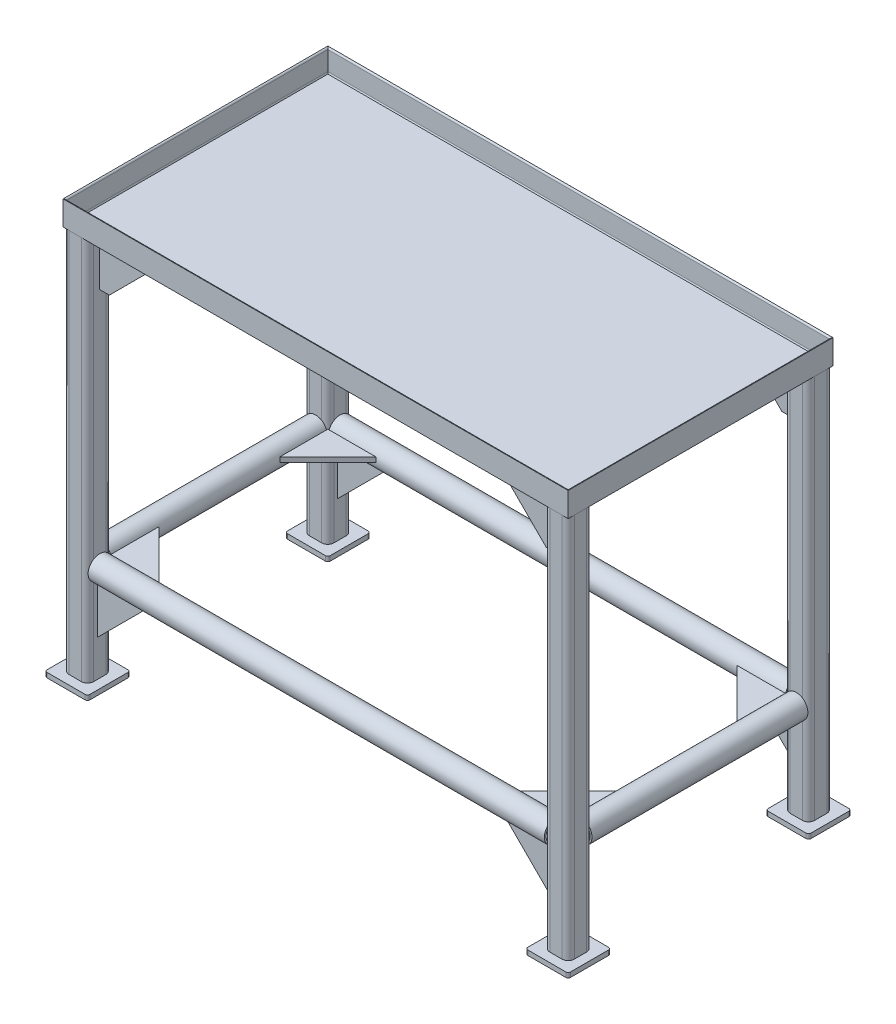
from build123d import *

# Parameters (mm, degrees)
ANGLE_IRON_2_X_2_X_0_125_1_DEPTH      = 598.242048969
ANGLE_IRON_2_X_2_X_0_125_1_DEPTH_BACK = 98.242048969
ANGLE_IRON_2_X_2_X_0_125_1_2_DEPTH    = 1196.484097937
ANGLE_IRON_2_X_2_X_0_125_1_3_DEPTH    = 696.484097937
ANGLE_IRON_2_X_2_X_0_125_1_4_DEPTH    = 1196.484097937
SQUARE_TUBE_2_X_2_X_0_25_1_DEPTH      = 800
SQUARE_TUBE_2_X_2_X_0_25_1_2_DEPTH    = 800
SQUARE_TUBE_2_X_2_X_0_25_1_3_DEPTH    = 800
SQUARE_TUBE_2_X_2_X_0_25_1_4_DEPTH    = 800
PIPE_1_5_SCH_40_1_DEPTH               = 1035.12497326
PIPE_1_5_SCH_40_1_DEPTH_BACK          = 35.12497326
SKETCH12_R                            = 24.13
SKETCH12_R_2                          = 20.447
SKETCH12_ON_SEGMENT_2_R               = 24.13
SKETCH12_ON_SEGMENT_2_R_2             = 20.447
PIPE_1_5_SCH_40_1_2_DEPTH             = 570.24994652
SKETCH12_ON_SEGMENT_3_R               = 24.13
SKETCH12_ON_SEGMENT_3_R_2             = 20.447
PIPE_1_5_SCH_40_1_3_DEPTH             = 1070.24994652
SKETCH12_ON_SEGMENT_4_R               = 24.13
SKETCH12_ON_SEGMENT_4_R_2             = 20.447
PIPE_1_5_SCH_40_1_4_DEPTH             = 570.24994652
SKETCH13_W                            = 1034.925
SKETCH13_H                            = 534.925
BOSS_EXTRUDE1_DEPTH                   = 5
GUSSET1_START                         = 240
GUSSET1_DEPTH                         = 10
GUSSET2_START                         = -600
GUSSET2_DEPTH                         = 10
GUSSET3_START                         = 245
GUSSET3_DEPTH                         = 10
END_START                             = -810
END_CAP1_DEPTH                        = 10


# Read off the part's stored shape, not the designer's step: Gusset1, Gusset2, Gusset3, End cap1
with BuildPart() as part:
    # Sketch1 → Angle iron 2 X 2 X 0.125(1) (new, two sides: drawn at the far end of the back side and taken through both)
    with BuildSketch(Plane(origin=(-525.4, 0, -250), x_dir=(1, 0, 0), z_dir=(0, 0, 1)).offset(-ANGLE_IRON_2_X_2_X_0_125_1_DEPTH_BACK)):
        with BuildLine():
            Line((0, 0), (0, 50.8))
            Line((0, 50.8), (0.00508, 50.8))
            ThreePointArc((0.00508, 50.8), (2.246551928, 49.871551928), (3.175, 47.63008))
            Line((3.175, 47.63008), (3.175, 7.9375))
            ThreePointArc((3.175, 7.9375), (4.569903955, 4.569903955), (7.9375, 3.175))
            Line((7.9375, 3.175), (47.63008, 3.175))
            ThreePointArc((47.63008, 3.175), (49.871551928, 2.246551928), (50.8, 0.00508))
            Line((50.8, 0.00508), (50.8, 0))
            Line((50.8, 0), (0, 0))
        make_face()
    extrude(amount=ANGLE_IRON_2_X_2_X_0_125_1_DEPTH + ANGLE_IRON_2_X_2_X_0_125_1_DEPTH_BACK)

    # Angle iron 2 X 2 X 0.125(1) mitre 1
    split(bisect_by=Plane(origin=(-500, 0, -250), x_dir=(0, -1, 0), z_dir=(-0.707106781, 0, 0.707106781)), keep=Keep.TOP)

    # Angle iron 2 X 2 X 0.125(1) mitre 2
    split(bisect_by=Plane(origin=(-500, 0, 250), x_dir=(0, -1, 0), z_dir=(-0.707106781, 0, -0.707106781)), keep=Keep.TOP)


with BuildPart() as body_2:
    # Sketch1 on segment 2 (carried to segment 2) → Angle iron 2 X 2 X 0.125_1 2 (new body)
    with BuildSketch(Plane(origin=(-598.242048969, 0, 275.4), x_dir=(0, 0, -1), z_dir=(1, 0, 0))):
        with BuildLine():
            Line((0, 0), (0, 50.8))
            Line((0, 50.8), (0.00508, 50.8))
            ThreePointArc((0.00508, 50.8), (2.246551928, 49.871551928), (3.175, 47.63008))
            Line((3.175, 47.63008), (3.175, 7.9375))
            ThreePointArc((3.175, 7.9375), (4.569903955, 4.569903955), (7.9375, 3.175))
            Line((7.9375, 3.175), (47.63008, 3.175))
            ThreePointArc((47.63008, 3.175), (49.871551928, 2.246551928), (50.8, 0.00508))
            Line((50.8, 0.00508), (50.8, 0))
            Line((50.8, 0), (0, 0))
        make_face()
    extrude(amount=ANGLE_IRON_2_X_2_X_0_125_1_2_DEPTH)

    # Angle iron 2 X 2 X 0.125_1 2 mitre 1
    split(bisect_by=Plane(origin=(-500, 0, 250), x_dir=(0, 1, 0), z_dir=(0.707106781, 0, 0.707106781)), keep=Keep.TOP)

    # Angle iron 2 X 2 X 0.125_1 2 mitre 2
    split(bisect_by=Plane(origin=(500, 0, 250), x_dir=(0, -1, 0), z_dir=(-0.707106781, 0, 0.707106781)), keep=Keep.TOP)


with BuildPart() as body_3:
    # Sketch1 on segment 3 (carried to segment 3) → Angle iron 2 X 2 X 0.125_1 3 (new body)
    with BuildSketch(Plane(origin=(525.4, 0, 348.242048969), x_dir=(-1, 0, 0), z_dir=(0, 0, -1))):
        with BuildLine():
            Line((0, 0), (0, 50.8))
            Line((0, 50.8), (0.00508, 50.8))
            ThreePointArc((0.00508, 50.8), (2.246551928, 49.871551928), (3.175, 47.63008))
            Line((3.175, 47.63008), (3.175, 7.9375))
            ThreePointArc((3.175, 7.9375), (4.569903955, 4.569903955), (7.9375, 3.175))
            Line((7.9375, 3.175), (47.63008, 3.175))
            ThreePointArc((47.63008, 3.175), (49.871551928, 2.246551928), (50.8, 0.00508))
            Line((50.8, 0.00508), (50.8, 0))
            Line((50.8, 0), (0, 0))
        make_face()
    extrude(amount=ANGLE_IRON_2_X_2_X_0_125_1_3_DEPTH)

    # Angle iron 2 X 2 X 0.125_1 3 mitre 1
    split(bisect_by=Plane(origin=(500, 0, -250), x_dir=(0, 1, 0), z_dir=(0.707106781, 0, 0.707106781)), keep=Keep.TOP)

    # Angle iron 2 X 2 X 0.125_1 3 mitre 2
    split(bisect_by=Plane(origin=(500, 0, 250), x_dir=(0, 1, 0), z_dir=(0.707106781, 0, -0.707106781)), keep=Keep.TOP)


with BuildPart() as body_4:
    # Sketch1 on segment 4 (carried to segment 4) → Angle iron 2 X 2 X 0.125_1 4 (new body)
    with BuildSketch(Plane(origin=(598.242048969, 0, -275.4), x_dir=(0, 0, 1), z_dir=(-1, 0, 0))):
        with BuildLine():
            Line((0, 0), (0, 50.8))
            Line((0, 50.8), (0.00508, 50.8))
            ThreePointArc((0.00508, 50.8), (2.246551928, 49.871551928), (3.175, 47.63008))
            Line((3.175, 47.63008), (3.175, 7.9375))
            ThreePointArc((3.175, 7.9375), (4.569903955, 4.569903955), (7.9375, 3.175))
            Line((7.9375, 3.175), (47.63008, 3.175))
            ThreePointArc((47.63008, 3.175), (49.871551928, 2.246551928), (50.8, 0.00508))
            Line((50.8, 0.00508), (50.8, 0))
            Line((50.8, 0), (0, 0))
        make_face()
    extrude(amount=ANGLE_IRON_2_X_2_X_0_125_1_4_DEPTH)

    # Angle iron 2 X 2 X 0.125_1 4 mitre 1
    split(bisect_by=Plane(origin=(-500, 0, -250), x_dir=(0, 1, 0), z_dir=(0.707106781, 0, -0.707106781)), keep=Keep.TOP)

    # Angle iron 2 X 2 X 0.125_1 4 mitre 2
    split(bisect_by=Plane(origin=(500, 0, -250), x_dir=(0, -1, 0), z_dir=(-0.707106781, 0, -0.707106781)), keep=Keep.TOP)


with BuildPart() as body_5:
    # Sketch11 → Square tube 2 X 2 X 0.25(1) (new body)
    with BuildSketch(Plane(origin=(-500, 0, 250), x_dir=(1, 0, 0), z_dir=(0, -1, 0))):
        with BuildLine():
            Line((-12.7, -25.4), (12.7, -25.4))
            ThreePointArc((12.7, -25.4), (21.680256121, -21.680256121), (25.4, -12.7))
            Line((25.4, -12.7), (25.4, 12.7))
            ThreePointArc((25.4, 12.7), (21.680256121, 21.680256121), (12.7, 25.4))
            Line((12.7, 25.4), (-12.7, 25.4))
            ThreePointArc((-12.7, 25.4), (-21.680256121, 21.680256121), (-25.4, 12.7))
            Line((-25.4, 12.7), (-25.4, -12.7))
            ThreePointArc((-25.4, -12.7), (-21.680256121, -21.680256121), (-12.7, -25.4))
        make_face()
        with BuildLine():
            Line((-12.7, -19.05), (12.7, -19.05))
            ThreePointArc((12.7, -19.05), (17.190128061, -17.190128061), (19.05, -12.7))
            Line((19.05, -12.7), (19.05, 12.7))
            ThreePointArc((19.05, 12.7), (17.190128061, 17.190128061), (12.7, 19.05))
            Line((12.7, 19.05), (-12.7, 19.05))
            ThreePointArc((-12.7, 19.05), (-17.190128061, 17.190128061), (-19.05, 12.7))
            Line((-19.05, 12.7), (-19.05, -12.7))
            ThreePointArc((-19.05, -12.7), (-17.190128061, -17.190128061), (-12.7, -19.05))
        make_face(mode=Mode.SUBTRACT)
    extrude(amount=SQUARE_TUBE_2_X_2_X_0_25_1_DEPTH)


with BuildPart() as body_6:
    # Sketch11 on segment 2 (carried to segment 2) → Square tube 2 X 2 X 0.25_1 2 (new body)
    with BuildSketch(Plane(origin=(500, 0, 250), x_dir=(1, 0, 0), z_dir=(0, -1, 0))):
        with BuildLine():
            Line((-12.7, -25.4), (12.7, -25.4))
            ThreePointArc((12.7, -25.4), (21.680256121, -21.680256121), (25.4, -12.7))
            Line((25.4, -12.7), (25.4, 12.7))
            ThreePointArc((25.4, 12.7), (21.680256121, 21.680256121), (12.7, 25.4))
            Line((12.7, 25.4), (-12.7, 25.4))
            ThreePointArc((-12.7, 25.4), (-21.680256121, 21.680256121), (-25.4, 12.7))
            Line((-25.4, 12.7), (-25.4, -12.7))
            ThreePointArc((-25.4, -12.7), (-21.680256121, -21.680256121), (-12.7, -25.4))
        make_face()
        with BuildLine():
            Line((-12.7, -19.05), (12.7, -19.05))
            ThreePointArc((12.7, -19.05), (17.190128061, -17.190128061), (19.05, -12.7))
            Line((19.05, -12.7), (19.05, 12.7))
            ThreePointArc((19.05, 12.7), (17.190128061, 17.190128061), (12.7, 19.05))
            Line((12.7, 19.05), (-12.7, 19.05))
            ThreePointArc((-12.7, 19.05), (-17.190128061, 17.190128061), (-19.05, 12.7))
            Line((-19.05, 12.7), (-19.05, -12.7))
            ThreePointArc((-19.05, -12.7), (-17.190128061, -17.190128061), (-12.7, -19.05))
        make_face(mode=Mode.SUBTRACT)
    extrude(amount=SQUARE_TUBE_2_X_2_X_0_25_1_2_DEPTH)


with BuildPart() as body_7:
    # Sketch11 on segment 3 (carried to segment 3) → Square tube 2 X 2 X 0.25_1 3 (new body)
    with BuildSketch(Plane(origin=(500, 0, -250), x_dir=(1, 0, 0), z_dir=(0, -1, 0))):
        with BuildLine():
            Line((-12.7, -25.4), (12.7, -25.4))
            ThreePointArc((12.7, -25.4), (21.680256121, -21.680256121), (25.4, -12.7))
            Line((25.4, -12.7), (25.4, 12.7))
            ThreePointArc((25.4, 12.7), (21.680256121, 21.680256121), (12.7, 25.4))
            Line((12.7, 25.4), (-12.7, 25.4))
            ThreePointArc((-12.7, 25.4), (-21.680256121, 21.680256121), (-25.4, 12.7))
            Line((-25.4, 12.7), (-25.4, -12.7))
            ThreePointArc((-25.4, -12.7), (-21.680256121, -21.680256121), (-12.7, -25.4))
        make_face()
        with BuildLine():
            Line((-12.7, -19.05), (12.7, -19.05))
            ThreePointArc((12.7, -19.05), (17.190128061, -17.190128061), (19.05, -12.7))
            Line((19.05, -12.7), (19.05, 12.7))
            ThreePointArc((19.05, 12.7), (17.190128061, 17.190128061), (12.7, 19.05))
            Line((12.7, 19.05), (-12.7, 19.05))
            ThreePointArc((-12.7, 19.05), (-17.190128061, 17.190128061), (-19.05, 12.7))
            Line((-19.05, 12.7), (-19.05, -12.7))
            ThreePointArc((-19.05, -12.7), (-17.190128061, -17.190128061), (-12.7, -19.05))
        make_face(mode=Mode.SUBTRACT)
    extrude(amount=SQUARE_TUBE_2_X_2_X_0_25_1_3_DEPTH)


with BuildPart() as body_8:
    # Sketch11 on segment 4 (carried to segment 4) → Square tube 2 X 2 X 0.25_1 4 (new body)
    with BuildSketch(Plane(origin=(-500, 0, -250), x_dir=(1, 0, 0), z_dir=(0, -1, 0))):
        with BuildLine():
            Line((-12.7, -25.4), (12.7, -25.4))
            ThreePointArc((12.7, -25.4), (21.680256121, -21.680256121), (25.4, -12.7))
            Line((25.4, -12.7), (25.4, 12.7))
            ThreePointArc((25.4, 12.7), (21.680256121, 21.680256121), (12.7, 25.4))
            Line((12.7, 25.4), (-12.7, 25.4))
            ThreePointArc((-12.7, 25.4), (-21.680256121, 21.680256121), (-25.4, 12.7))
            Line((-25.4, 12.7), (-25.4, -12.7))
            ThreePointArc((-25.4, -12.7), (-21.680256121, -21.680256121), (-12.7, -25.4))
        make_face()
        with BuildLine():
            Line((-12.7, -19.05), (12.7, -19.05))
            ThreePointArc((12.7, -19.05), (17.190128061, -17.190128061), (19.05, -12.7))
            Line((19.05, -12.7), (19.05, 12.7))
            ThreePointArc((19.05, 12.7), (17.190128061, 17.190128061), (12.7, 19.05))
            Line((12.7, 19.05), (-12.7, 19.05))
            ThreePointArc((-12.7, 19.05), (-17.190128061, 17.190128061), (-19.05, 12.7))
            Line((-19.05, 12.7), (-19.05, -12.7))
            ThreePointArc((-19.05, -12.7), (-17.190128061, -17.190128061), (-12.7, -19.05))
        make_face(mode=Mode.SUBTRACT)
    extrude(amount=SQUARE_TUBE_2_X_2_X_0_25_1_4_DEPTH)


with BuildPart() as body_9:
    # Sketch12 → Pipe 1.5 SCH 40(1) (new, two sides: drawn at the far end of the back side and taken through both)
    with BuildSketch(Plane(origin=(-500, -600, -250), x_dir=(0, 0, -1), z_dir=(1, 0, 0)).offset(-PIPE_1_5_SCH_40_1_DEPTH_BACK)):
        Circle(SKETCH12_R)
        Circle(SKETCH12_R_2, mode=Mode.SUBTRACT)
    extrude(amount=PIPE_1_5_SCH_40_1_DEPTH + PIPE_1_5_SCH_40_1_DEPTH_BACK)

    # Pipe 1.5 SCH 40(1) mitre 1
    split(bisect_by=Plane(origin=(-500, -600, -250), x_dir=(0, 1, 0), z_dir=(0.707106781, 0, -0.707106781)), keep=Keep.TOP)

    # Pipe 1.5 SCH 40(1) mitre 2
    split(bisect_by=Plane(origin=(500, -600, -250), x_dir=(0, -1, 0), z_dir=(-0.707106781, 0, -0.707106781)), keep=Keep.TOP)

    # Trim_Extend1 9
    split(bisect_by=Plane(origin=(474.6, -400, 250), x_dir=(0, -1, 0), z_dir=(-1, 0, 0)), keep=Keep.TOP)

    # Trim_Extend1 101
    split(bisect_by=Plane(origin=(-474.6, -400, 250), x_dir=(0, 1, 0), z_dir=(1, 0, 0)), keep=Keep.TOP)


with BuildPart() as body_10:
    # Sketch12 on segment 2 (carried to segment 2) → Pipe 1.5 SCH 40_1 2 (new body)
    with BuildSketch(Plane(origin=(500, -600, -285.12497326), x_dir=(1, 0, 0), z_dir=(0, 0, 1))):
        Circle(SKETCH12_ON_SEGMENT_2_R)
        Circle(SKETCH12_ON_SEGMENT_2_R_2, mode=Mode.SUBTRACT)
    extrude(amount=PIPE_1_5_SCH_40_1_2_DEPTH)

    # Pipe 1.5 SCH 40_1 2 mitre 1
    split(bisect_by=Plane(origin=(500, -600, -250), x_dir=(0, 1, 0), z_dir=(0.707106781, 0, 0.707106781)), keep=Keep.TOP)

    # Pipe 1.5 SCH 40_1 2 mitre 2
    split(bisect_by=Plane(origin=(500, -600, 250), x_dir=(0, 1, 0), z_dir=(0.707106781, 0, -0.707106781)), keep=Keep.TOP)

    # Trim/Extend1
    split(bisect_by=Plane(origin=(500, -400, 224.6), x_dir=(0, 1, 0), z_dir=(0, 0, -1)), keep=Keep.TOP)

    # Trim_Extend1 48
    split(bisect_by=Plane(origin=(500, -400, -224.6), x_dir=(0, -1, 0), z_dir=(0, 0, 1)), keep=Keep.TOP)


with BuildPart() as body_11:
    # Sketch12 on segment 3 (carried to segment 3) → Pipe 1.5 SCH 40_1 3 (new body)
    with BuildSketch(Plane(origin=(535.12497326, -600, 250), x_dir=(0, 0, 1), z_dir=(-1, 0, 0))):
        Circle(SKETCH12_ON_SEGMENT_3_R)
        Circle(SKETCH12_ON_SEGMENT_3_R_2, mode=Mode.SUBTRACT)
    extrude(amount=PIPE_1_5_SCH_40_1_3_DEPTH)

    # Pipe 1.5 SCH 40_1 3 mitre 1
    split(bisect_by=Plane(origin=(-500, -600, 250), x_dir=(0, 1, 0), z_dir=(0.707106781, 0, 0.707106781)), keep=Keep.TOP)

    # Pipe 1.5 SCH 40_1 3 mitre 2
    split(bisect_by=Plane(origin=(500, -600, 250), x_dir=(0, -1, 0), z_dir=(-0.707106781, 0, 0.707106781)), keep=Keep.TOP)

    # Trim_Extend1 9
    split(bisect_by=Plane(origin=(474.6, -400, 250), x_dir=(0, -1, 0), z_dir=(-1, 0, 0)), keep=Keep.TOP)

    # Trim_Extend1 101
    split(bisect_by=Plane(origin=(-474.6, -400, 250), x_dir=(0, 1, 0), z_dir=(1, 0, 0)), keep=Keep.TOP)


with BuildPart() as body_12:
    # Sketch12 on segment 4 (carried to segment 4) → Pipe 1.5 SCH 40_1 4 (new body)
    with BuildSketch(Plane(origin=(-500, -600, 285.12497326), x_dir=(-1, 0, 0), z_dir=(0, 0, -1))):
        Circle(SKETCH12_ON_SEGMENT_4_R)
        Circle(SKETCH12_ON_SEGMENT_4_R_2, mode=Mode.SUBTRACT)
    extrude(amount=PIPE_1_5_SCH_40_1_4_DEPTH)

    # Pipe 1.5 SCH 40_1 4 mitre 1
    split(bisect_by=Plane(origin=(-500, -600, -250), x_dir=(0, -1, 0), z_dir=(-0.707106781, 0, 0.707106781)), keep=Keep.TOP)

    # Pipe 1.5 SCH 40_1 4 mitre 2
    split(bisect_by=Plane(origin=(-500, -600, 250), x_dir=(0, -1, 0), z_dir=(-0.707106781, 0, -0.707106781)), keep=Keep.TOP)

    # Trim/Extend1
    split(bisect_by=Plane(origin=(500, -400, 224.6), x_dir=(0, 1, 0), z_dir=(0, 0, -1)), keep=Keep.TOP)

    # Trim_Extend1 48
    split(bisect_by=Plane(origin=(500, -400, -224.6), x_dir=(0, -1, 0), z_dir=(0, 0, 1)), keep=Keep.TOP)


with BuildPart() as body_13:
    # Sketch13 → Boss-Extrude1 (new body)
    with BuildSketch(Plane(origin=(0, 3.175, 0), x_dir=(1, 0, 0), z_dir=(0, 1, 0))):
        Rectangle(SKETCH13_W, SKETCH13_H)
    extrude(amount=BOSS_EXTRUDE1_DEPTH)


with BuildPart() as body_14:
    # Gusset1 outline → Gusset1 (new body)
    with BuildSketch(Plane.XY.offset(GUSSET1_START)):
        Polygon((-474.6, -100), (-454.6, -100), (-374.6, -20), (-374.6, 0), (-474.6, 0), align=None)
    extrude(amount=GUSSET1_DEPTH)


with BuildPart() as body_15:
    # Gusset2 outline → Gusset2 (new body)
    with BuildSketch(Plane(origin=(0, 0, 0), x_dir=(1, 0, 0), z_dir=(0, 1, 0)).offset(GUSSET2_START)):
        Polygon((-375.87, -225.87), (-475.87, -125.87), (-475.87, -225.87), align=None)
    extrude(amount=GUSSET2_DEPTH)


with BuildPart() as body_16:
    # Gusset3 outline → Gusset3 (new body)
    with BuildSketch(Plane.XY.offset(GUSSET3_START)):
        Polygon((-474.6, -724.13), (-374.6, -624.13), (-474.6, -624.13), align=None)
    extrude(amount=GUSSET3_DEPTH)


with BuildPart() as body_17:
    # Mirror1: mirrored copy
    add(body_16.part.mirror(Plane(origin=(0, 0, 0), x_dir=(0, 0, 1), z_dir=(1, 0, 0))))


with BuildPart() as body_18:
    # Mirror1 2: mirrored copy
    add(body_15.part.mirror(Plane(origin=(0, 0, 0), x_dir=(0, 0, 1), z_dir=(1, 0, 0))))


with BuildPart() as body_19:
    # Mirror1 3: mirrored copy
    add(body_14.part.mirror(Plane(origin=(0, 0, 0), x_dir=(0, 0, 1), z_dir=(1, 0, 0))))


with BuildPart() as body_20:
    # Mirror2: mirrored copy
    add(body_14.part.mirror(Plane.XY))


with BuildPart() as body_21:
    # Mirror2 2: mirrored copy
    add(body_16.part.mirror(Plane.XY))


with BuildPart() as body_22:
    # Mirror2 3: mirrored copy
    add(body_15.part.mirror(Plane.XY))


with BuildPart() as body_23:
    # Mirror2 4: mirrored copy
    add(body_19.part.mirror(Plane.XY))


with BuildPart() as body_24:
    # Mirror2 5: mirrored copy
    add(body_17.part.mirror(Plane.XY))


with BuildPart() as body_25:
    # Mirror2 6: mirrored copy
    add(body_18.part.mirror(Plane.XY))


with BuildPart() as body_26:
    # End cap1 outline → End cap1 (new body)
    with BuildSketch(Plane(origin=(0, 0, 0), x_dir=(1, 0, 0), z_dir=(0, 1, 0)).offset(END_START)):
        with BuildLine():
            Line((-544.45, -210.55), (-544.45, -289.45))
            ThreePointArc((-544.45, -289.45), (-542.985533906, -292.985533906), (-539.45, -294.45))
            Line((-539.45, -294.45), (-460.55, -294.45))
            ThreePointArc((-460.55, -294.45), (-457.014466094, -292.985533906), (-455.55, -289.45))
            Line((-455.55, -289.45), (-455.55, -210.55))
            ThreePointArc((-455.55, -210.55), (-457.014466094, -207.014466094), (-460.55, -205.55))
            Line((-460.55, -205.55), (-539.45, -205.55))
            ThreePointArc((-539.45, -205.55), (-542.985533906, -207.014466094), (-544.45, -210.55))
        make_face()
    extrude(amount=END_CAP1_DEPTH)


with BuildPart() as body_27:
    # Mirror3: mirrored copy
    add(body_26.part.mirror(Plane.XY))


with BuildPart() as body_28:
    # Mirror4: mirrored copy
    add(body_26.part.mirror(Plane(origin=(0, 0, 0), x_dir=(0, 0, 1), z_dir=(1, 0, 0))))


with BuildPart() as body_29:
    # Mirror4 2: mirrored copy
    add(body_27.part.mirror(Plane(origin=(0, 0, 0), x_dir=(0, 0, 1), z_dir=(1, 0, 0))))


solid = Compound([part.part, body_2.part, body_3.part, body_4.part, body_5.part, body_6.part, body_7.part, body_8.part, body_9.part, body_10.part, body_11.part, body_12.part, body_13.part, body_14.part, body_15.part, body_16.part, body_17.part, body_18.part, body_19.part, body_20.part, body_21.part, body_22.part, body_23.part, body_24.part, body_25.part, body_26.part, body_27.part, body_28.part, body_29.part])
